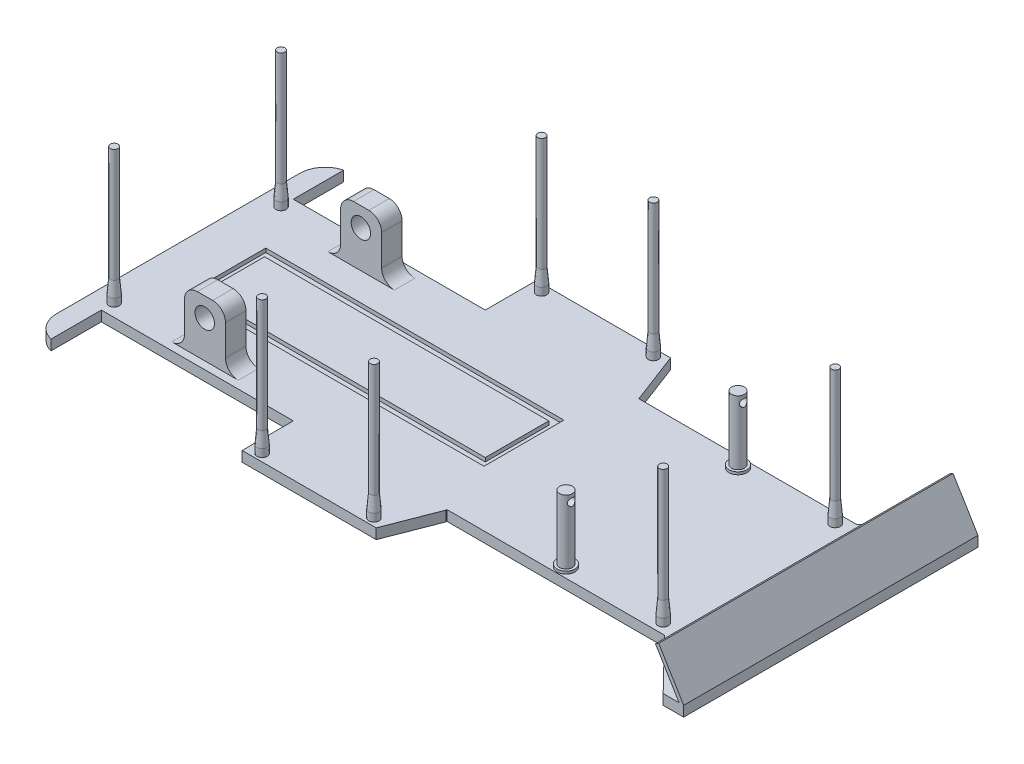
from build123d import *

# Parameters (mm, degrees)
BOSS_EXTRUDE1_DEPTH   = 4
SKETCH2_W             = 85
SKETCH2_H             = 20
SKETCH2_W_2           = 75
CUT_EXTRUDE1_DEPTH    = 10
SKETCH3_W             = 241.859305237
SKETCH3_H             = 4
SKETCH3_W_2           = 3
SKETCH3_H_2           = 95
SKETCH3_H_3           = 50
BOSS_EXTRUDE3_DEPTH   = 4
SKETCH5_W             = 111.05
SKETCH5_H             = 24.8
CUT_EXTRUDE3_DEPTH    = 1.5
SKETCH6_R             = 3.5
BOSS_EXTRUDE4_DEPTH   = 1
SKETCH7_R             = 2.5
BOSS_EXTRUDE5_DEPTH   = 25
SKETCH9_R             = 2
BOSS_EXTRUDE6_DEPTH   = 3
BOSS_EXTRUDE6_2_DEPTH = 3
SKETCH10_R            = 1.5
BOSS_EXTRUDE7_DEPTH   = 50
BOSS_EXTRUDE7_2_DEPTH = 50
SKETCH13_R            = 2
BOSS_EXTRUDE8_DEPTH   = 3
SKETCH14_R            = 1.5
BOSS_EXTRUDE9_DEPTH   = 50
SKETCH16_R            = 2
BOSS_EXTRUDE10_DEPTH  = 3
SKETCH17_R            = 1.5
BOSS_EXTRUDE11_DEPTH  = 50
SKETCH29_R            = 3.8
BOSS_EXTRUDE13_DEPTH  = 8
SKETCH30_W            = 115
SKETCH30_H            = 4
BOSS_EXTRUDE14_DEPTH  = 25
CUT_EXTRUDE5_DEPTH    = 25
CUT_EXTRUDE6_DEPTH    = 25
BOSS_EXTRUDE15_DEPTH  = 115
SKETCH36_R            = 1.5
CUT_EXTRUDE9_DEPTH    = 89


# Read off the part's stored shape, not the designer's step: Boss-Extrude12, Mirror1
with BuildPart() as part:
    # Sketch1 → Boss-Extrude1 (new body)
    with BuildSketch(Plane(origin=(0, 0, 0), x_dir=(1, 0, 0), z_dir=(0, 1, 0))):
        with BuildLine():
            Line((105, 57.5), (115, 57.5))
            Line((115, 57.5), (115, 47.5))
            Line((115, 47.5), (115, -47.5))
            Line((115, -47.5), (115, -57.5))
            Line((115, -57.5), (105, -57.5))
            Line((105, -57.5), (-105, -57.5))
            ThreePointArc((-105, -57.5), (-112.071067812, -54.571067812), (-115, -47.5))
            Line((-115, -47.5), (-115, 47.5))
            ThreePointArc((-115, 47.5), (-112.071067812, 54.571067812), (-105, 57.5))
            Line((-105, 57.5), (105, 57.5))
        make_face()
    extrude(amount=BOSS_EXTRUDE1_DEPTH)

    # Sketch2 → Cut-Extrude1 (cut)
    with BuildSketch(Plane(origin=(0, 4, 0), x_dir=(1, 0, 0), z_dir=(0, 1, 0))):
        with Locations((70, 47.5)):
            Rectangle(SKETCH2_W, SKETCH2_H)
        with Locations((-70, 47.5)):
            Rectangle(SKETCH2_W_2, SKETCH2_H)
        with Locations((70, -47.5)):
            Rectangle(SKETCH2_W, SKETCH2_H)
        with Locations((-70, -47.5)):
            Rectangle(SKETCH2_W_2, SKETCH2_H)
    extrude(amount=-CUT_EXTRUDE1_DEPTH, mode=Mode.SUBTRACT)

    # Sketch5 → Cut-Extrude3 (cut)
    with BuildSketch(Plane(origin=(0, 4, 0), x_dir=(1, 0, 0), z_dir=(0, 1, 0))):
        Polygon((20.1, -12.5), (20.1, -15.6), (-96.35, -15.6), (-96.35, -12.5), (-96.35, 15.6), (20.1, 15.6), align=None)
        with Locations((-38.125, 0)):
            Rectangle(SKETCH5_W, SKETCH5_H, mode=Mode.SUBTRACT)
    extrude(amount=-CUT_EXTRUDE3_DEPTH, mode=Mode.SUBTRACT)

    # Sketch30 → Boss-Extrude14 (add)
    with BuildSketch(Plane(origin=(115, 0, 0), x_dir=(0, 0, -1), z_dir=(1, 0, 0))):
        with Locations((0, 2)):
            Rectangle(SKETCH30_W, SKETCH30_H)
    extrude(amount=BOSS_EXTRUDE14_DEPTH)

    # Sketch31 → Cut-Extrude5 (cut)
    with BuildSketch(Plane(origin=(0, 4, 0), x_dir=(1, 0, 0), z_dir=(0, 1, 0))):
        Polygon((112.5, 57.5), (112.5, 37.5), (132, 57.5), align=None)
        Polygon((132, -57.5), (112.5, -37.5), (112.5, -57.5), align=None)
    extrude(amount=-CUT_EXTRUDE5_DEPTH, mode=Mode.SUBTRACT)

    # Sketch32 → Cut-Extrude6 (cut)
    with BuildSketch(Plane(origin=(0, 4, 0), x_dir=(1, 0, 0), z_dir=(0, 1, 0))):
        Polygon((27.5, 37.5), (19.846080108, 57.6), (27.6, 57.6), align=None)
        Polygon((19.846080108, -57.6), (27.6, -37.6), (27.5, -57.5), align=None)
    extrude(amount=-CUT_EXTRUDE6_DEPTH, mode=Mode.SUBTRACT)

    # Sketch34 → Boss-Extrude15 (add)
    with BuildSketch(Plane(origin=(0, 0, -57.5), x_dir=(-1, 0, 0), z_dir=(0, 0, -1))):
        Polygon((-140, 4), (-130.258621034, 20.112980478), (-128.974975321, 19.336930426), (-138.247179905, 4), align=None)
    extrude(amount=-BOSS_EXTRUDE15_DEPTH)


with BuildPart() as body_2:
    # Sketch3 → Boss-Extrude3 (new body)
    with BuildSketch(Plane.XZ):
        with Locations((13.773530926, 15)):
            Rectangle(SKETCH3_W, SKETCH3_H)
        with Locations((13.773530926, -15)):
            Rectangle(SKETCH3_W, SKETCH3_H)
        with Locations((11, 0)):
            Rectangle(SKETCH3_W_2, SKETCH3_H_2)
        with Locations((-16, 0)):
            Rectangle(SKETCH3_W_2, SKETCH3_H_2)
        with Locations((65.156121692, 0)):
            Rectangle(SKETCH3_W_2, SKETCH3_H_3)
        with Locations((-106.156121692, 0)):
            Rectangle(SKETCH3_W_2, SKETCH3_H_3)
        with Locations((-65.156121692, 0)):
            Rectangle(SKETCH3_W_2, SKETCH3_H_3)
        with Locations((106.156121692, 0)):
            Rectangle(SKETCH3_W_2, SKETCH3_H_3)
    extrude(amount=BOSS_EXTRUDE3_DEPTH)


with BuildPart() as body_3:
    # Sketch6 → Boss-Extrude4 (new body)
    with BuildSketch(Plane(origin=(0, 4, 0), x_dir=(1, 0, 0), z_dir=(0, 1, 0))):
        with Locations(Location((70.137825647, 33.6, 0), (0, 0, 270))):
            Circle(SKETCH6_R)
    extrude(amount=BOSS_EXTRUDE4_DEPTH)


with BuildPart() as body_4:
    # Sketch7 → Boss-Extrude5 (new body)
    with BuildSketch(Plane(origin=(0, 5, 0), x_dir=(1, 0, 0), z_dir=(0, 1, 0))):
        with Locations(Location((70.137825647, 33.6, 0), (0, 0, 270))):
            Circle(SKETCH7_R)
    extrude(amount=BOSS_EXTRUDE5_DEPTH)

    # Sketch36 → Cut-Extrude9 (cut)
    with BuildSketch(Plane(origin=(140, 0, 0), x_dir=(0, 0, -1), z_dir=(1, 0, 0))):
        with Locations((33.599058463, 27.2)):
            Circle(SKETCH36_R)
    extrude(amount=-CUT_EXTRUDE9_DEPTH, mode=Mode.SUBTRACT)


with BuildPart() as body_5:
    # Sketch9 → Boss-Extrude6 (new body)
    with BuildSketch(Plane(origin=(0, 4, 0), x_dir=(1, 0, 0), z_dir=(0, 1, 0))):
        with Locations(Location((-27.6, 54.6, 0), (0, 0, 270))):
            Circle(SKETCH9_R)
    extrude(amount=BOSS_EXTRUDE6_DEPTH)



with BuildPart() as body_6:
    # Sketch9 → Boss-Extrude6 2 (new body)
    with BuildSketch(Plane(origin=(0, 4, 0), x_dir=(1, 0, 0), z_dir=(0, 1, 0))):
        with Locations(Location((16.1, 54.6, 0), (0, 0, 270))):
            Circle(SKETCH9_R)
    extrude(amount=BOSS_EXTRUDE6_2_DEPTH)


with BuildPart() as body_7:
    # Sketch10 → Boss-Extrude7 (new body)
    with BuildSketch(Plane(origin=(0, 7, 0), x_dir=(1, 0, 0), z_dir=(0, 1, 0))):
        with Locations(Location((-27.6, 54.6, 0), (0, 0, 270))):
            Circle(SKETCH10_R)
    extrude(amount=BOSS_EXTRUDE7_DEPTH)


with BuildPart() as body_8:
    # Sketch10 → Boss-Extrude7 2 (new body)
    with BuildSketch(Plane(origin=(0, 7, 0), x_dir=(1, 0, 0), z_dir=(0, 1, 0))):
        with Locations(Location((16.1, 54.6, 0), (0, 0, 270))):
            Circle(SKETCH10_R)
    extrude(amount=BOSS_EXTRUDE7_2_DEPTH)


with BuildPart() as body_9:
    # Sketch13 → Boss-Extrude8 (new body)
    with BuildSketch(Plane(origin=(0, 4, 0), x_dir=(1, 0, 0), z_dir=(0, 1, 0))):
        with Locations(Location((108.1, 33.6, 0), (0, 0, 270))):
            Circle(SKETCH13_R)
    extrude(amount=BOSS_EXTRUDE8_DEPTH)


with BuildPart() as body_10:
    # Sketch14 → Boss-Extrude9 (new body)
    with BuildSketch(Plane(origin=(0, 7, 0), x_dir=(1, 0, 0), z_dir=(0, 1, 0))):
        with Locations(Location((108.1, 33.6, 0), (0, 0, 270))):
            Circle(SKETCH14_R)
    extrude(amount=BOSS_EXTRUDE9_DEPTH)


with BuildPart() as body_11:
    # Sketch16 → Boss-Extrude10 (new body)
    with BuildSketch(Plane(origin=(0, 4, 0), x_dir=(1, 0, 0), z_dir=(0, 1, 0))):
        with Locations(Location((-107.4, 32.6, 0), (0, 0, 270))):
            Circle(SKETCH16_R)
    extrude(amount=BOSS_EXTRUDE10_DEPTH)


with BuildPart() as body_12:
    # Sketch17 → Boss-Extrude11 (new body)
    with BuildSketch(Plane(origin=(0, 7, 0), x_dir=(1, 0, 0), z_dir=(0, 1, 0))):
        with Locations(Location((-107.4, 32.6, 0), (0, 0, 270))):
            Circle(SKETCH17_R)
    extrude(amount=BOSS_EXTRUDE11_DEPTH)


with BuildPart() as body_5_1:
    add(body_5.part)

    add(body_7.part)  # Boss-Extrude12 merges body 7

    add(body_8.part)  # Boss-Extrude12 merges body 8

    add(body_6.part)  # Boss-Extrude12 merges body 6

    add(body_9.part)  # Boss-Extrude12 merges body 9

    add(body_10.part)  # Boss-Extrude12 merges body 10

    add(body_11.part)  # Boss-Extrude12 merges body 11

    add(body_12.part)  # Boss-Extrude12 merges body 12
    # Boss-Extrude12 outline → Boss-Extrude12 (revolve)
    with BuildSketch(Plane(origin=(-107.4, 0, -32.6), x_dir=(1, 0, 0), z_dir=(0, 0, 1))):
        Polygon((2, 7), (1.5, 12.715026151), (1.5, 7), align=None)
    revolve(axis=Axis((-107.4, 0, -32.6), (0, 1, 0)))

    # Boss-Extrude12 2 outline → Boss-Extrude12 2 (revolve)
    with BuildSketch(Plane(origin=(108.1, 0, -33.6), x_dir=(1, 0, 0), z_dir=(0, 0, 1))):
        Polygon((2, 7), (1.5, 12.715026151), (1.5, 7), align=None)
    revolve(axis=Axis((108.1, 0, -33.6), (0, 1, 0)))

    # Boss-Extrude12 3 outline → Boss-Extrude12 3 (revolve)
    with BuildSketch(Plane(origin=(16.1, 0, -54.6), x_dir=(1, 0, 0), z_dir=(0, 0, 1))):
        Polygon((2, 7), (1.5, 12.715026151), (1.5, 7), align=None)
    revolve(axis=Axis((16.1, 0, -54.6), (0, 1, 0)))

    # Boss-Extrude12 4 outline → Boss-Extrude12 4 (revolve)
    with BuildSketch(Plane(origin=(-27.6, 0, -54.6), x_dir=(1, 0, 0), z_dir=(0, 0, 1))):
        Polygon((2, 7), (1.5, 12.715026151), (1.5, 7), align=None)
    revolve(axis=Axis((-27.6, 0, -54.6), (0, 1, 0)))


with BuildPart() as body_6_2:
    # Mirror1 outline → Mirror1 (revolve)
    with BuildSketch(Plane(origin=(108.1, 0, 33.6), x_dir=(1, 0, 0), z_dir=(0, 0, 1))):
        Polygon((2, 4), (2, 7), (1.5, 12.715026151), (1.5, 57), (0, 57), (0, 4), align=None)
    revolve(axis=Axis((108.1, 0, 33.6), (0, 1, 0)))


with BuildPart() as body_7_2:
    # Mirror1 2 outline → Mirror1 2 (revolve)
    with BuildSketch(Plane(origin=(16.1, 0, 54.6), x_dir=(1, 0, 0), z_dir=(0, 0, 1))):
        Polygon((0, 57), (0, 4), (2, 4), (2, 7), (1.5, 12.715026151), (1.5, 57), align=None)
    revolve(axis=Axis((16.1, 0, 54.6), (0, 1, 0)))


with BuildPart() as body_8_2:
    # Mirror1 3 outline → Mirror1 3 (revolve)
    with BuildSketch(Plane(origin=(-27.6, 0, 54.6), x_dir=(1, 0, 0), z_dir=(0, 0, 1))):
        Polygon((0, 57), (0, 4), (2, 4), (2, 7), (1.5, 12.715026151), (1.5, 57), align=None)
    revolve(axis=Axis((-27.6, 0, 54.6), (0, 1, 0)))


with BuildPart() as body_9_2:
    # Mirror1 4 outline → Mirror1 4 (revolve)
    with BuildSketch(Plane(origin=(-107.4, 0, 32.6), x_dir=(1, 0, 0), z_dir=(0, 0, 1))):
        Polygon((0, 57), (0, 4), (2, 4), (2, 7), (1.5, 12.715026151), (1.5, 57), align=None)
    revolve(axis=Axis((-107.4, 0, 32.6), (0, 1, 0)))


with BuildPart() as body_10_2:
    # Sketch29 → Boss-Extrude13 (new body)
    with BuildSketch(Plane.XY.offset(26.5)):
        with BuildLine():
            Line((-78, 9), (-78, 21))
            ThreePointArc((-78, 21), (-76.535533906, 24.535533906), (-73, 26))
            Line((-73, 26), (-67, 26))
            ThreePointArc((-67, 26), (-63.464466094, 24.535533906), (-62, 21))
            Line((-62, 21), (-62, 9))
            ThreePointArc((-62, 9), (-60.535533906, 5.464466094), (-57, 4))
            Line((-57, 4), (-83, 4))
            ThreePointArc((-83, 4), (-79.464466094, 5.464466094), (-78, 9))
        make_face()
        with Locations((-70.1, 18.5)):
            Circle(SKETCH29_R, mode=Mode.SUBTRACT)
    extrude(amount=BOSS_EXTRUDE13_DEPTH)


with BuildPart() as body_11_2:
    # Mirror3: mirrored copy
    add(body_10_2.part.mirror(Plane.XY))


with BuildPart() as body_12_2:
    # Mirror4: mirrored copy
    add(body_4.part.mirror(Plane.XY))


with BuildPart() as body_13:
    # Mirror4 2: mirrored copy
    add(body_3.part.mirror(Plane.XY))


solid = Compound([part.part, body_2.part, body_3.part, body_4.part, body_5_1.part, body_6_2.part, body_7_2.part, body_8_2.part, body_9_2.part, body_10_2.part, body_11_2.part, body_12_2.part, body_13.part])
